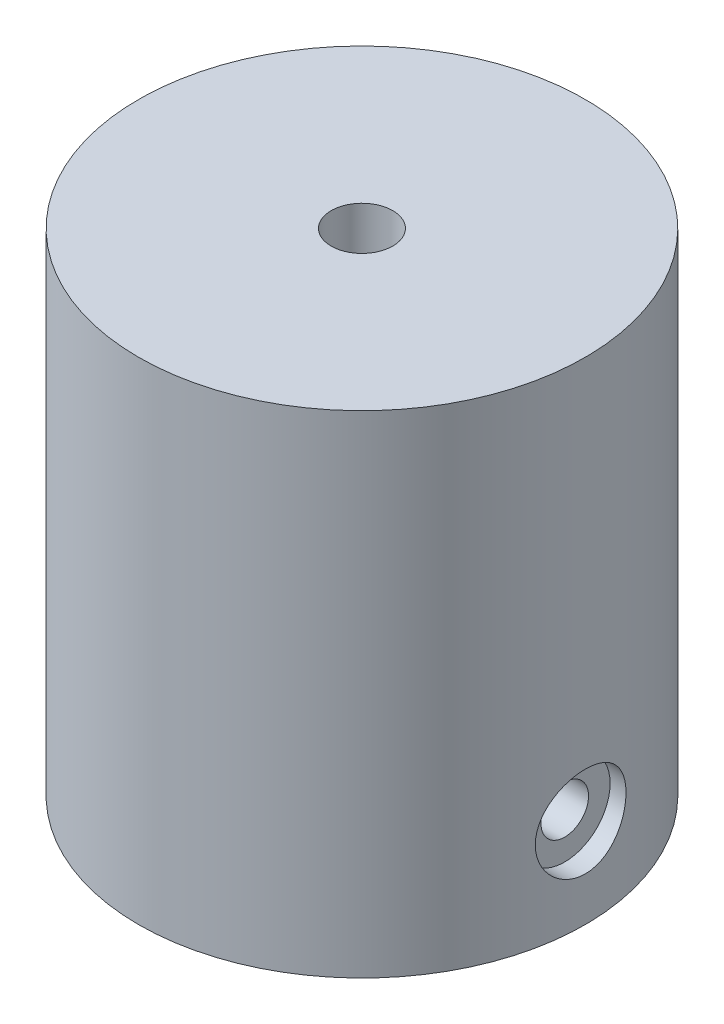
from build123d import *

# Parameters (mm, degrees)
SKETCH1_R             = 12.7
BOSS_EXTRUDE1_DEPTH   = 27.94
F_3_0MM_DOWEL_HOLE2_D = 3.5
SKETCH8_R             = 11.2
SKETCH8_R_2           = 2.75
CUT_EXTRUDE1_DEPTH    = 2.54


# Read off the part's stored shape, not the designer's step: CBORE for #2 Button Head Cap Screw1
with BuildPart() as part:
    # Sketch1 → Boss-Extrude1 (new body)
    with BuildSketch(Plane(origin=(0, 0, 0), x_dir=(1, 0, 0), z_dir=(0, 1, 0))):
        with Locations(Location((0, 0, 0), (0, 0, 270))):
            Circle(SKETCH1_R)
    extrude(amount=BOSS_EXTRUDE1_DEPTH)

    # Ø3.0mm Dowel Hole2 (through all)
    with Locations(Plane(origin=(0, 27.94, 0), x_dir=(1, 0, 0), z_dir=(0, 1, 0))):
        with Locations((0, 0)):
            Hole(F_3_0MM_DOWEL_HOLE2_D / 2)

    # CBORE for #2 Button Head Cap Screw1 outl → CBORE for #2 Button Head Cap Screw1 (revolve, cut)
    with BuildSketch(Plane(origin=(0, 5.08, 0), x_dir=(0, 1, 0), z_dir=(0, 0, -1))):
        Polygon((1.35255, 11.5316), (2.57937, 11.5316), (2.57937, 12.700038915), (0, 12.700038915), (0, 1.110061146), (1.35255, 1.110061146), align=None)
    revolve(axis=Axis((0, 5.08, 0), (1, 0, 0)), mode=Mode.SUBTRACT)

    # Sketch8 → Cut-Extrude1 (cut)
    with BuildSketch(Plane.XZ):
        with Locations(Location((0, 0, 0), (0, 0, 270))):
            Circle(SKETCH8_R)
        with Locations(Location((0, 0, 0), (0, 0, 270))):
            Circle(SKETCH8_R_2, mode=Mode.SUBTRACT)
    extrude(amount=-CUT_EXTRUDE1_DEPTH, mode=Mode.SUBTRACT)


solid = part.part
